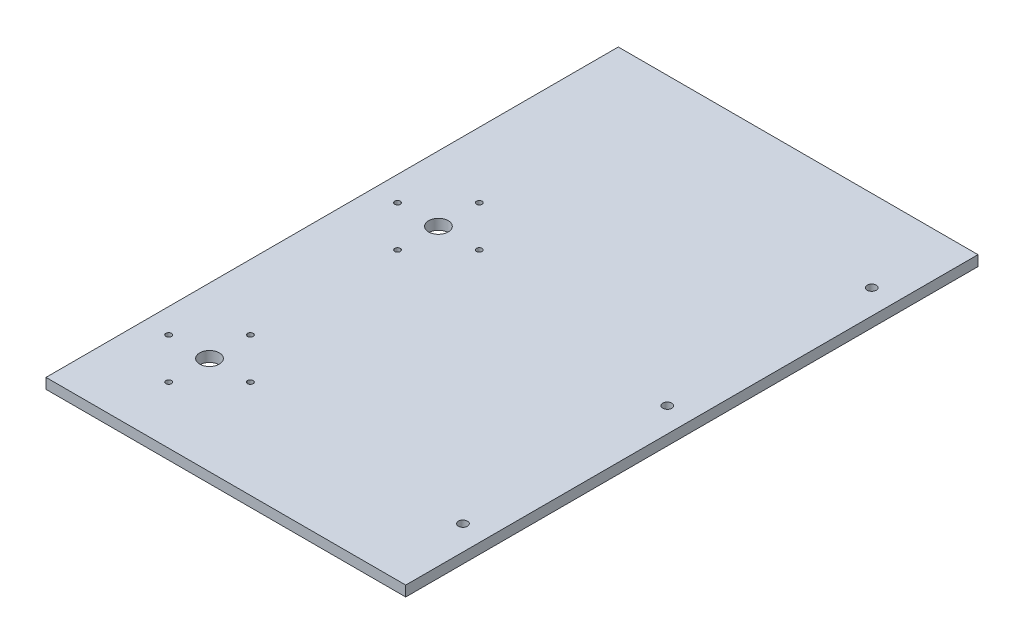
from build123d import *

# Parameters (mm, degrees)
SKETCH1_W            = 220
SKETCH1_H            = 350
BOSS_EXTRUDE1_DEPTH  = 6.35
SKETCH2_R            = 6
SKETCH2_R_2          = 1.7
CUT_EXTRUDE1_DEPTH   = 207.797781661
M5_CLEARANCE_HOLE1_D = 5.5
LPATTERN1_COUNT      = 2
LPATTERN1_PITCH      = 140


with BuildPart() as part:
    # Sketch1 → Boss-Extrude1 (new body)
    with BuildSketch(Plane(origin=(0, 0, 0), x_dir=(1, 0, 0), z_dir=(0, 1, 0))):
        Rectangle(SKETCH1_W, SKETCH1_H)
    extrude(amount=BOSS_EXTRUDE1_DEPTH)

    # Sketch2 → Cut-Extrude1 (cut, through all)
    with BuildSketch(Plane(origin=(0, 6.35, 0), x_dir=(1, 0, 0), z_dir=(0, 1, 0))):
        with Locations((-70, -115)):
            Circle(SKETCH2_R)
        with Locations((-70, -90)):
            Circle(SKETCH2_R_2)
        with Locations((-45, -115)):
            Circle(SKETCH2_R_2)
        with Locations((-70, -140)):
            Circle(SKETCH2_R_2)
        with Locations((-95, -115)):
            Circle(SKETCH2_R_2)
    cut_extrude1 = extrude(amount=-CUT_EXTRUDE1_DEPTH, mode=Mode.SUBTRACT)

    # M5 Clearance Hole1 (through all)
    with Locations(Plane(origin=(0, 6.35, 0), x_dir=(1, 0, 0), z_dir=(0, 1, 0))):
        with Locations((95, -125), (95, 0), (95, 125)):
            Hole(M5_CLEARANCE_HOLE1_D / 2)

    # LPattern1: Cut-Extrude1 ×2
    with Locations(*[(0, 0, -i * LPATTERN1_PITCH) for i in range(1, LPATTERN1_COUNT)]):
        add(cut_extrude1, mode=Mode.SUBTRACT)


solid = part.part
